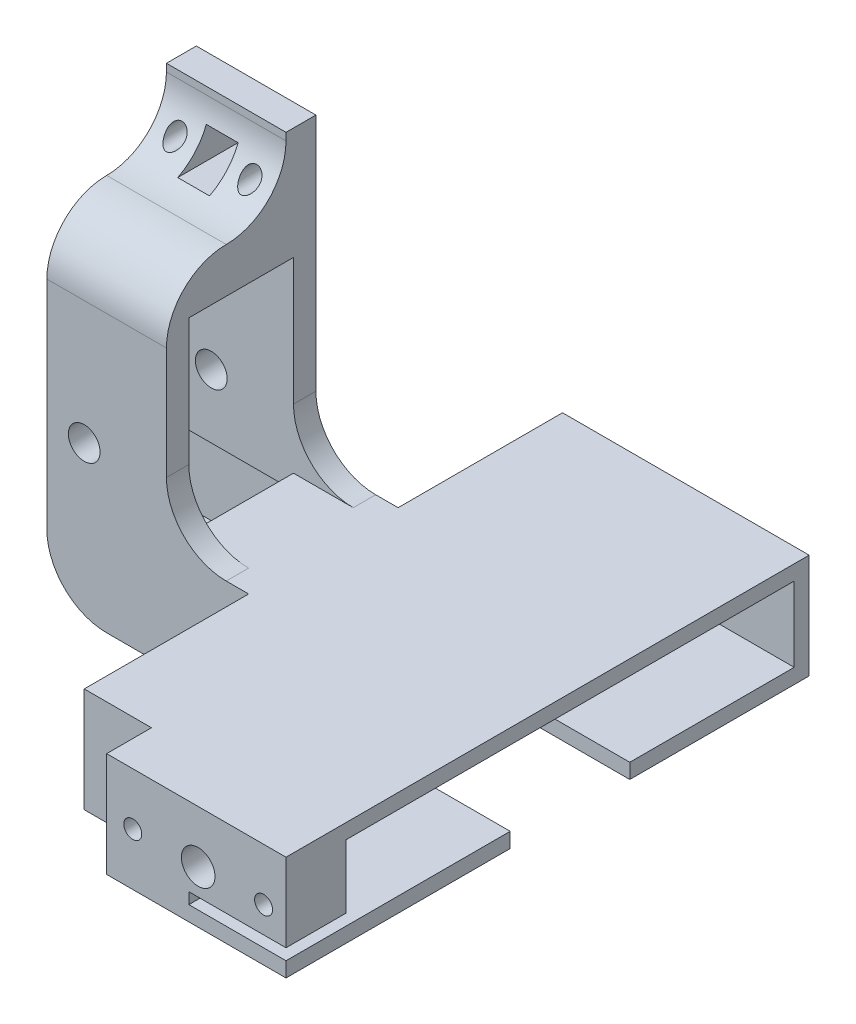
from build123d import *

# Parameters (mm, degrees)
SKETCH1_R           = 2.125
SKETCH1_R_2         = 1.25
SKETCH1_W           = 4.25
SKETCH1_H           = 4.25
BOSS_EXTRUDE1_DEPTH = 20
SKETCH2_W           = 14
SKETCH2_H           = 37
SKETCH2_W_2         = 16
SKETCH2_H_2         = 9
CUT_EXTRUDE1_DEPTH  = 73.470683728
SKETCH3_W           = 33
SKETCH3_H           = 22
BOSS_EXTRUDE2_DEPTH = 14
CUT_EXTRUDE2_DEPTH  = 31
SKETCH5_W           = 16
SKETCH5_H           = 10
CUT_EXTRUDE3_DEPTH  = 29
SKETCH7_R           = 4
CUT_EXTRUDE5_DEPTH  = 2
SKETCH8_W           = 24
SKETCH8_H           = 14
SKETCH8_R           = 1.2
SKETCH8_R_2         = 2.25
BOSS_EXTRUDE3_DEPTH = 6
CUT_EXTRUDE6_START  = -8
SKETCH9_R           = 2.25
SKETCH9_R_2         = 1.2
SKETCH9_W           = 13
SKETCH9_H           = 1.5
CUT_EXTRUDE6_DEPTH  = 8
FILLET1_R           = 8


with BuildPart() as part:
    # Sketch1 → Boss-Extrude1 (new body)
    with BuildSketch(Plane.XY):
        Polygon((16, 54), (0, 54), (0, 0), (60, 0), (60, 14), (16, 14), align=None)
        with Locations((5, 20.5)):
            Circle(SKETCH1_R, mode=Mode.SUBTRACT)
        with Locations((13, 48)):
            Circle(SKETCH1_R_2, mode=Mode.SUBTRACT)
        with Locations((3, 48)):
            Circle(SKETCH1_R_2, mode=Mode.SUBTRACT)
        with Locations((8, 48)):
            Rectangle(SKETCH1_W, SKETCH1_H, mode=Mode.SUBTRACT)
    extrude(amount=BOSS_EXTRUDE1_DEPTH)

    # Sketch2 → Cut-Extrude1 (cut, through all)
    with BuildSketch(Plane(origin=(16, 0, 0), x_dir=(0, 0, -1), z_dir=(1, 0, 0))):
        with Locations((-10, 20.5)):
            Rectangle(SKETCH2_W, SKETCH2_H)
        with Locations((-12, 49.5)):
            Rectangle(SKETCH2_W_2, SKETCH2_H_2)
    extrude(amount=-CUT_EXTRUDE1_DEPTH, mode=Mode.SUBTRACT)

    # Sketch3 → Boss-Extrude2 (add)
    with BuildSketch(Plane.XZ):
        with Locations((43.5, 31)):
            Rectangle(SKETCH3_W, SKETCH3_H)
        with Locations((43.5, -11)):
            Rectangle(SKETCH3_W, SKETCH3_H)
    extrude(amount=-BOSS_EXTRUDE2_DEPTH)

    # Sketch4 → Cut-Extrude2 (cut)
    with BuildSketch(Plane(origin=(60, 0, 0), x_dir=(0, 0, -1), z_dir=(1, 0, 0))):
        Polygon((-18, 0), (-18, 2), (-40, 2), (-40, 12), (20, 12), (20, 2), (-2, 2), (-2, 0), align=None)
    extrude(amount=-CUT_EXTRUDE2_DEPTH, mode=Mode.SUBTRACT)

    # Sketch5 → Cut-Extrude3 (cut)
    with BuildSketch(Plane(origin=(29, 0, 0), x_dir=(0, 0, -1), z_dir=(1, 0, 0))):
        with Locations((-10, 7)):
            Rectangle(SKETCH5_W, SKETCH5_H)
    extrude(amount=-CUT_EXTRUDE3_DEPTH, mode=Mode.SUBTRACT)

    # Sketch7 → Cut-Extrude5 (cut)
    with BuildSketch(Plane.XY.offset(-20)):
        with Locations((45, 7.3)):
            Circle(SKETCH7_R)
    extrude(amount=-CUT_EXTRUDE5_DEPTH, mode=Mode.SUBTRACT)

    # Sketch8 → Boss-Extrude3 (add)
    with BuildSketch(Plane.XY.offset(42)):
        with Locations((48, 7)):
            Rectangle(SKETCH8_W, SKETCH8_H)
        with Locations((57, 7)):
            Circle(SKETCH8_R, mode=Mode.SUBTRACT)
        with Locations((48.25, 7)):
            Circle(SKETCH8_R_2, mode=Mode.SUBTRACT)
        with Locations(Location((39.5, 7, 0), (0, 0, 180))):
            Circle(SKETCH8_R, mode=Mode.SUBTRACT)
    extrude(amount=BOSS_EXTRUDE3_DEPTH)

    # Sketch9 → Cut-Extrude6 (cut)
    with BuildSketch(Plane.XY.offset(48).offset(CUT_EXTRUDE6_START)):
        with Locations((48.25, 7)):
            Circle(SKETCH9_R)
        with Locations((57, 7)):
            Circle(SKETCH9_R_2)
        with Locations(Location((39.5, 7, 0), (0, 0, 180))):
            Circle(SKETCH9_R_2)
        with Locations((53.5, 2.75)):
            Rectangle(SKETCH9_W, SKETCH9_H)
    extrude(amount=CUT_EXTRUDE6_DEPTH, mode=Mode.SUBTRACT)

    # Fillet1
    # the kernel refuses this fillet: 8 mm, written as the material it adds along each edge
    with BuildSketch(Plane(origin=(16, 14, 0), x_dir=(0, 1, 0), z_dir=(0, 0, 1)), Plane(origin=(16, 14, 17), x_dir=(0, 1, 0), z_dir=(0, 0, 1))) as fillet1_piece_1:
        with BuildLine():
            CenterArc((FILLET1_R, -FILLET1_R), FILLET1_R, 90, 90)
            Line((0, -FILLET1_R), (0, 0))
            Line((0, 0), (FILLET1_R, 0))
        make_face()
    extrude(amount=3)
    with BuildSketch(Plane(origin=(16, 14, -20), x_dir=(0, 1, 0), z_dir=(0, 0, 1))) as fillet1_piece_2_section:
        with BuildLine():
            CenterArc((FILLET1_R, -FILLET1_R), FILLET1_R, 90, 90)
            Line((0, -FILLET1_R), (0, 0))
            Line((0, 0), (FILLET1_R, 0))
        make_face()
    fillet1_piece_2 = extrude(amount=43, mode=Mode.PRIVATE)
    fillet1_piece_2 = split(fillet1_piece_2, bisect_by=Plane(origin=(17.786943512, 15.786943512, 17), z_dir=(0, 0, 1)), keep=Keep.TOP, mode=Mode.PRIVATE)
    fillet1_piece_2 = split(fillet1_piece_2, bisect_by=Plane(origin=(17.786943512, 15.786943512, 20), z_dir=(0, 0, -1)), keep=Keep.TOP, mode=Mode.PRIVATE)
    add(fillet1_piece_2)
    with BuildSketch(Plane(origin=(16, 14, -3), x_dir=(0, 1, 0), z_dir=(0, 0, 1))) as fillet1_piece_3_section:
        with BuildLine():
            CenterArc((FILLET1_R, -FILLET1_R), FILLET1_R, 90, 90)
            Line((0, -FILLET1_R), (0, 0))
            Line((0, 0), (FILLET1_R, 0))
        make_face()
    fillet1_piece_3 = extrude(amount=43, mode=Mode.PRIVATE)
    fillet1_piece_3 = split(fillet1_piece_3, bisect_by=Plane(origin=(17.786943512, 15.786943512, 3), z_dir=(0, 0, -1)), keep=Keep.TOP, mode=Mode.PRIVATE)
    fillet1_piece_3 = split(fillet1_piece_3, bisect_by=Plane(origin=(17.786943512, 15.786943512, 0), z_dir=(0, 0, 1)), keep=Keep.TOP, mode=Mode.PRIVATE)
    add(fillet1_piece_3)
    with BuildSketch(Plane(origin=(16, 45, 4), x_dir=(0, 0, 1), z_dir=(-1, 0, 0))) as fillet1_piece_4_section:
        with BuildLine():
            CenterArc((FILLET1_R, FILLET1_R), FILLET1_R, 180, 90)
            Line((0, FILLET1_R), (0, 0))
            Line((0, 0), (FILLET1_R, 0))
        make_face()
    fillet1_piece_4 = extrude(amount=36, mode=Mode.PRIVATE)
    fillet1_piece_4 = fillet1_piece_4 - Plane(origin=(13, 48, 6.838985296), x_dir=(1, 0, 0), z_dir=(0, 0, -1)) * Cylinder(1.25, 105, mode=Mode.PRIVATE)
    fillet1_piece_4 = split(fillet1_piece_4, bisect_by=Plane(origin=(10.125, 45.39955256, 6.838985296), z_dir=(1, 0, 0)), keep=Keep.TOP, mode=Mode.PRIVATE)
    add(fillet1_piece_4)
    with BuildSketch(Plane(origin=(36, 45, 4), x_dir=(0, 0, 1), z_dir=(-1, 0, 0))) as fillet1_piece_5_section:
        with BuildLine():
            CenterArc((FILLET1_R, FILLET1_R), FILLET1_R, 180, 90)
            Line((0, FILLET1_R), (0, 0))
            Line((0, 0), (FILLET1_R, 0))
        make_face()
    fillet1_piece_5 = extrude(amount=36, mode=Mode.PRIVATE)
    fillet1_piece_5 = split(fillet1_piece_5, bisect_by=Plane(origin=(8, 45.875, 6.838985296), z_dir=(0, -1, 0)), keep=Keep.TOP, mode=Mode.PRIVATE)
    fillet1_piece_5 = split(fillet1_piece_5, bisect_by=Plane(origin=(10.125, 45.39955256, 6.838985296), z_dir=(-1, 0, 0)), keep=Keep.TOP, mode=Mode.PRIVATE)
    add(fillet1_piece_5)
    with BuildSketch(Plane(origin=(36, 45, 4), x_dir=(0, 0, 1), z_dir=(-1, 0, 0))) as fillet1_piece_6_section:
        with BuildLine():
            CenterArc((FILLET1_R, FILLET1_R), FILLET1_R, 180, 90)
            Line((0, FILLET1_R), (0, 0))
            Line((0, 0), (FILLET1_R, 0))
        make_face()
    fillet1_piece_6 = extrude(amount=36, mode=Mode.PRIVATE)
    fillet1_piece_6 = split(fillet1_piece_6, bisect_by=Plane(origin=(8, 50.125, 4.159374376), z_dir=(0, 1, 0)), keep=Keep.TOP, mode=Mode.PRIVATE)
    fillet1_piece_6 = split(fillet1_piece_6, bisect_by=Plane(origin=(10.125, 50.838860547, 4.159374376), z_dir=(-1, 0, 0)), keep=Keep.TOP, mode=Mode.PRIVATE)
    add(fillet1_piece_6)
    with BuildSketch(Plane(origin=(36, 45, 4), x_dir=(0, 0, 1), z_dir=(-1, 0, 0))) as fillet1_piece_7_section:
        with BuildLine():
            CenterArc((FILLET1_R, FILLET1_R), FILLET1_R, 180, 90)
            Line((0, FILLET1_R), (0, 0))
            Line((0, 0), (FILLET1_R, 0))
        make_face()
    fillet1_piece_7 = extrude(amount=36, mode=Mode.PRIVATE)
    fillet1_piece_7 = split(fillet1_piece_7, bisect_by=Plane(origin=(5.875, 46.341604388, 7.503816855), z_dir=(-1, 0, 0)), keep=Keep.TOP, mode=Mode.PRIVATE)
    fillet1_piece_7 = fillet1_piece_7 - Plane(origin=(3, 48, 7.503816855), x_dir=(1, 0, 0), z_dir=(0, 0, -1)) * Cylinder(1.25, 105, mode=Mode.PRIVATE)
    add(fillet1_piece_7)
    # the kernel refuses this fillet: 8 mm, written as the material it takes off along each edge
    with BuildSketch(Plane(origin=(0, 0, -20), x_dir=(0, 1, 0), z_dir=(0, 0, 1))) as fillet1_2_piece_1:
        with BuildLine():
            CenterArc((FILLET1_R, -FILLET1_R), FILLET1_R, 90, 90)
            Line((0, -FILLET1_R), (0, 0))
            Line((0, 0), (FILLET1_R, 0))
        make_face()
    extrude(amount=60, mode=Mode.SUBTRACT)
    with BuildSketch(Plane(origin=(36, 45, 20), x_dir=(0, 0, -1), z_dir=(-1, 0, 0))) as fillet1_2_piece_2:
        with BuildLine():
            CenterArc((FILLET1_R, FILLET1_R), FILLET1_R, 180, 90)
            Line((0, FILLET1_R), (0, 0))
            Line((0, 0), (FILLET1_R, 0))
        make_face()
    extrude(amount=56, mode=Mode.SUBTRACT)


solid = part.part
